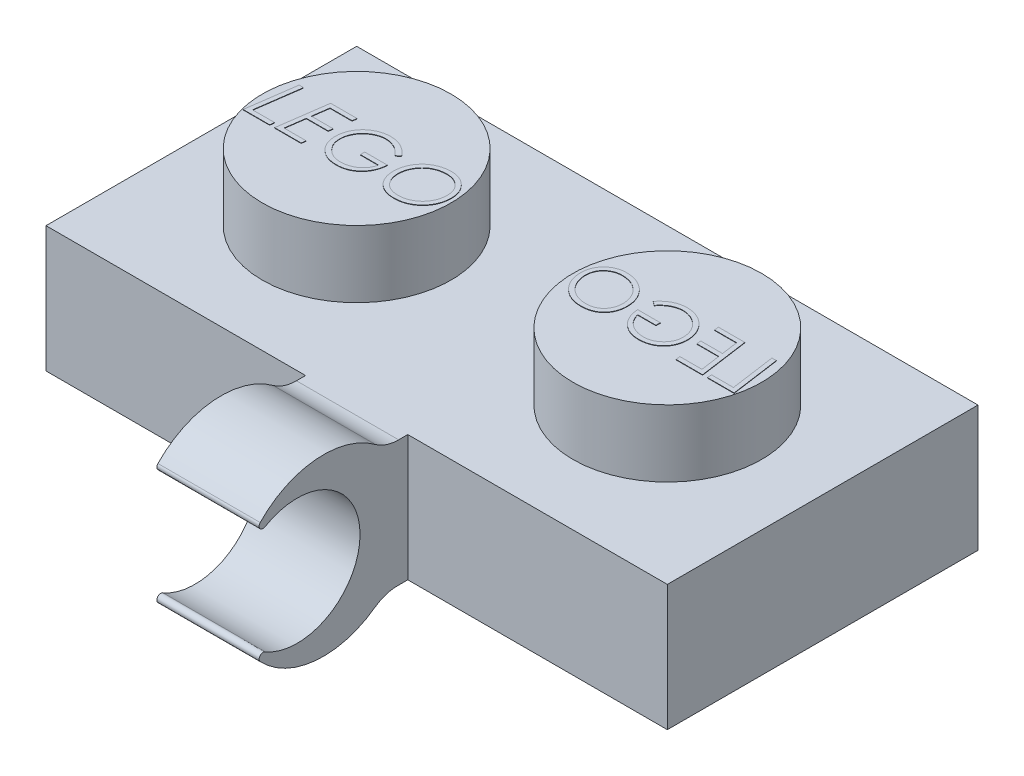
from build123d import *

# Parameters (mm, degrees)
SKETCH1_W                = 7.9
SKETCH1_H                = 7.9
BOSS_EXTRUDE1_DEPTH      = 3.2
SKETCH2_R                = 2.4
BOSS_EXTRUDE2_DEPTH      = 1.7
BOSS_EXTRUDE4_DEPTH      = 0.01
SKETCH4_W                = 6.679581062
SKETCH4_H                = 6.679581062
CUT_EXTRUDE1_DEPTH       = 2.01
BOSS_EXTRUDE5_START      = -2.01
SKETCH5_R                = 1.021947204
SKETCH5_R_2              = 1.041114876
SKETCH5_R_3              = 1.016069602
BOSS_EXTRUDE5_DEPTH      = 2.01
BOSS_EXTRUDE7_DEPTH      = 1.3
BOSS_EXTRUDE7_DEPTH_BACK = 1.3
FILLET2_R                = 0.1
FILLET5_R                = 1


with BuildPart() as part:
    # Sketch1 → Boss-Extrude1 (new body)
    with BuildSketch(Plane(origin=(0, 0, 0), x_dir=(1, 0, 0), z_dir=(0, 1, 0))):
        with Locations((3.95, 3.95)):
            Rectangle(SKETCH1_W, SKETCH1_H)
    extrude(amount=BOSS_EXTRUDE1_DEPTH)

    # Sketch2 → Boss-Extrude2 (add)
    with BuildSketch(Plane(origin=(0, 3.2, 0), x_dir=(1, 0, 0), z_dir=(0, 1, 0))):
        with Locations((3.95, 3.95)):
            Circle(SKETCH2_R)
    extrude(amount=BOSS_EXTRUDE2_DEPTH)

    # Sketch3 → Boss-Extrude4 (add)
    # profile 1 of 4: a face of its own
    with BuildSketch(Plane(origin=(0, 4.9, 0), x_dir=(1, 0, 0), z_dir=(0, 1, 0))):
        Polygon((1.832282536, 4.604898123), (1.945463626, 4.604898123), (1.785708017, 3.46707761), (2.346104652, 3.46707761), (2.331831815, 3.354898123), (1.657002088, 3.354898123), align=None)
    # profile 2 of 4: a face of its own
    with BuildSketch(Plane(origin=(0, 4.9, 0), x_dir=(1, 0, 0), z_dir=(0, 1, 0))):
        Polygon((3.307643113, 4.604898123), (3.289864668, 4.492718636), (2.730720036, 4.492718636), (2.672376687, 4.076051969), (3.227514908, 4.076051969), (3.211489267, 3.963872482), (2.656351046, 3.963872482), (2.586990069, 3.46707761), (3.147386703, 3.46707761), (3.132863466, 3.354898123), (2.458284139, 3.354898123), (2.633564588, 4.604898123), align=None)
    # profile 3 of 4: a face of its own
    with BuildSketch(Plane(origin=(0, 4.9, 0), x_dir=(1, 0, 0), z_dir=(0, 1, 0))):
        with BuildLine():
            Line((4.701873883, 4.341727049), (4.602214428, 4.268359661))
            add(Edge.make_bspline(
                [(4.602214428, 4.268359661), (4.594223081, 4.278463296), (4.578382454, 4.298490949), (4.552974208, 4.326751799), (4.526781942, 4.353389692), (4.49925824, 4.377917229), (4.471083571, 4.40112998), (4.441525281, 4.42204341), (4.410978563, 4.441207159), (4.379659496, 4.458649755), (4.347610579, 4.474125482), (4.315396207, 4.487732834), (4.282869127, 4.498922357), (4.250283005, 4.50864136), (4.217299487, 4.51587276), (4.18414763, 4.520710487), (4.150903008, 4.524293062), (4.128633082, 4.524610402), (4.117438786, 4.524769918)],
                knots=[0, 0, 0, 0, 1.088205139, 2.157064813, 3.209299296, 4.24303109, 5.270682624, 6.292193363, 7.299904734, 8.316436989, 9.319473328, 10.305733085, 11.269264382, 12.22444877, 13.177574148, 14.119122834, 15.054550362, 16, 16, 16, 16], degree=3))
            add(Edge.make_bspline(
                [(4.117438786, 4.524769918), (4.104994375, 4.524521107), (4.080132736, 4.524024028), (4.043033101, 4.520256885), (4.006376299, 4.51354748), (3.969908323, 4.504926578), (3.933893833, 4.493301772), (3.898252767, 4.479273564), (3.86309309, 4.462612711), (3.828430169, 4.443710217), (3.794953431, 4.422557236), (3.762954424, 4.399818018), (3.733183783, 4.375017311), (3.704650221, 4.34913067), (3.678490591, 4.320990985), (3.654040353, 4.291325456), (3.631570613, 4.259970376), (3.610753816, 4.22729124), (3.592321888, 4.193377608), (3.576332398, 4.158696131), (3.562301633, 4.123622124), (3.551463822, 4.087613068), (3.542488613, 4.051135011), (3.536702509, 4.013925289), (3.532682003, 3.976230124), (3.532229884, 3.950862463), (3.532002088, 3.938081216)],
                knots=[0, 0, 0, 0, 0.97704485, 1.95195533, 2.923843304, 3.901415526, 4.89212417, 5.89249681, 6.906854198, 7.94508701, 8.99059592, 10.014519948, 11.024825533, 12.031297736, 13.037428488, 14.038509295, 15.047964276, 16.064309815, 17.079005887, 18.075937854, 19.061713623, 20.042247028, 21.026191147, 22.008802999, 22.996754876, 24, 24, 24, 24], degree=3))
            add(Edge.make_bspline(
                [(3.532002088, 3.938081216), (3.532369323, 3.920940483), (3.533092921, 3.887166428), (3.54080397, 3.83756171), (3.552297071, 3.789703796), (3.569345009, 3.743984102), (3.590663785, 3.700113704), (3.616898701, 3.658340736), (3.647995923, 3.618632516), (3.683169388, 3.581124089), (3.721975609, 3.547190184), (3.762989457, 3.517071082), (3.806208637, 3.491553815), (3.851780792, 3.471217023), (3.899058754, 3.454481236), (3.948703848, 3.443615036), (4.000192874, 3.436168993), (4.035279814, 3.435410998), (4.053085822, 3.435026328)],
                knots=[0, 0, 0, 0, 1.019699772, 2.00921373, 2.981850619, 3.945611549, 4.907936516, 5.881372837, 6.876399243, 7.906447893, 8.938173367, 9.941073143, 10.932270214, 11.919723139, 12.908225854, 13.912405215, 14.940582182, 16, 16, 16, 16], degree=3))
            add(Edge.make_bspline(
                [(4.053085822, 3.435026328), (4.074581254, 3.435599426), (4.11748625, 3.436743331), (4.180872469, 3.447608002), (4.243162184, 3.464003995), (4.303115661, 3.48756372), (4.359892332, 3.516274774), (4.411741714, 3.54979345), (4.457784869, 3.587961635), (4.498384943, 3.630580026), (4.53303885, 3.678554542), (4.563120551, 3.731230233), (4.587740602, 3.789373269), (4.599634966, 3.830601123), (4.605720036, 3.851692995)],
                knots=[0, 0, 0, 0, 1.033792167, 2.063454529, 3.086685911, 4.12966393, 5.157365104, 6.144632769, 7.094686579, 8.02963692, 8.969786061, 9.935985671, 10.944065236, 12, 12, 12, 12], degree=3))
            Line((4.605720036, 3.851692995), (4.140976447, 3.851692995))
            Line((4.140976447, 3.851692995), (4.140976447, 3.963872482))
            Line((4.140976447, 3.963872482), (4.717899524, 3.963872482))
            add(Edge.make_bspline(
                [(4.717899524, 3.963872482), (4.715864452, 3.940537279), (4.711874195, 3.894782885), (4.69942647, 3.828086612), (4.68199329, 3.764774229), (4.659173945, 3.704861641), (4.630919519, 3.648505742), (4.59774963, 3.595348644), (4.559285746, 3.545571633), (4.515814341, 3.499721655), (4.46844757, 3.458302738), (4.417878433, 3.421925394), (4.364351012, 3.391393009), (4.308182236, 3.366007973), (4.248908241, 3.346854494), (4.187007442, 3.33278705), (4.12217798, 3.324364805), (4.078067373, 3.323359246), (4.055589828, 3.322846841)],
                knots=[0, 0, 0, 0, 1.098006248, 2.152910829, 3.176693714, 4.174102283, 5.154427425, 6.128677043, 7.108165613, 8.099464247, 9.087077226, 10.054952015, 11.015803916, 11.972468591, 12.940477937, 13.931877037, 14.946141749, 16, 16, 16, 16], degree=3))
            add(Edge.make_bspline(
                [(4.055589828, 3.322846841), (4.032525547, 3.323342362), (3.987411429, 3.324311611), (3.9214857, 3.332876212), (3.858807865, 3.34620412), (3.799404334, 3.365318809), (3.743277296, 3.389857102), (3.690679177, 3.420179827), (3.641268759, 3.455657405), (3.595689928, 3.496348401), (3.554559756, 3.541197331), (3.518567584, 3.589307242), (3.487743642, 3.639999747), (3.462901044, 3.693721351), (3.443468533, 3.750181555), (3.429856098, 3.809437188), (3.421311108, 3.871476007), (3.420325278, 3.913764014), (3.419822601, 3.935326809)],
                knots=[0, 0, 0, 0, 1.117903688, 2.186638197, 3.21780727, 4.221242465, 5.20706516, 6.182431358, 7.159609539, 8.151436913, 9.139682433, 10.10533578, 11.060397566, 12.011007066, 12.969638005, 13.950363306, 14.954883424, 16, 16, 16, 16], degree=3))
            add(Edge.make_bspline(
                [(3.419822601, 3.935326809), (3.420138952, 3.950859376), (3.420767729, 3.981731803), (3.424963713, 4.027616327), (3.432679126, 4.072646659), (3.442852825, 4.116910735), (3.455965552, 4.160496846), (3.471933961, 4.20328178), (3.491087489, 4.245242481), (3.513047729, 4.286115161), (3.537530339, 4.325600602), (3.564271155, 4.363247138), (3.593498243, 4.398542313), (3.624507556, 4.432098501), (3.658146201, 4.463054417), (3.693847346, 4.491888255), (3.731480716, 4.518905381), (3.77142415, 4.543221398), (3.812846375, 4.565137356), (3.855118915, 4.584605211), (3.898469674, 4.600573637), (3.942428974, 4.613905323), (3.987291028, 4.624144078), (4.032916476, 4.631801844), (4.079465257, 4.63599767), (4.110753822, 4.636631416), (4.12645321, 4.636949405)],
                knots=[0, 0, 0, 0, 1.01034602, 2.008157081, 2.993527994, 3.979930372, 4.960683832, 5.951959865, 6.948100503, 7.958563211, 8.967975239, 9.968308804, 10.959584837, 11.946808627, 12.938010319, 13.930059161, 14.930392727, 15.949048275, 16.969091794, 17.977364349, 18.973726886, 19.971641333, 20.963333569, 21.964771492, 22.978801278, 24, 24, 24, 24], degree=3))
            add(Edge.make_bspline(
                [(4.12645321, 4.636949405), (4.140647989, 4.63666956), (4.168739982, 4.636115737), (4.210476499, 4.63288549), (4.251380819, 4.627152534), (4.29129634, 4.618801418), (4.330484053, 4.608567941), (4.368675988, 4.59577053), (4.406070924, 4.580754735), (4.442474857, 4.563343269), (4.478143584, 4.543914061), (4.512619765, 4.521658579), (4.546625807, 4.497640881), (4.579591338, 4.471153536), (4.611552577, 4.442077414), (4.642675265, 4.410871755), (4.673242279, 4.377555225), (4.692243855, 4.353777591), (4.701873883, 4.341727049)],
                knots=[0, 0, 0, 0, 1.015105213, 2.008930748, 2.991454354, 3.966534974, 4.923490216, 5.886087319, 6.844809209, 7.803252371, 8.770243484, 9.747130909, 10.735853235, 11.746297741, 12.768902994, 13.824016992, 14.897208497, 16, 16, 16, 16], degree=3))
        make_face()
    # profile 4 of 4: a face of its own
    with BuildSketch(Plane(origin=(0, 4.9, 0), x_dir=(1, 0, 0), z_dir=(0, 1, 0))):
        with BuildLine():
            add(Edge.make_bspline(
                [(5.671925966, 4.636949405), (5.692400623, 4.63650345), (5.732667893, 4.635626396), (5.791703582, 4.627669814), (5.84816478, 4.614697282), (5.901922783, 4.596339067), (5.953136821, 4.572927607), (6.001690741, 4.544284414), (6.047399306, 4.510158163), (6.09025375, 4.471611385), (6.129154607, 4.429051867), (6.163160058, 4.383201547), (6.192058383, 4.334734533), (6.215910086, 4.283554512), (6.233823478, 4.229366588), (6.246743033, 4.172603876), (6.255145963, 4.113110877), (6.255950492, 4.072491917), (6.256361062, 4.051763107)],
                knots=[0, 0, 0, 0, 1.061681398, 2.087996504, 3.083659545, 4.062660971, 5.02945529, 5.999994507, 6.981138296, 7.983640916, 8.985844288, 9.966988076, 10.939736476, 11.908342154, 12.890058995, 13.894159216, 14.925339913, 16, 16, 16, 16], degree=3))
            add(Edge.make_bspline(
                [(6.256361062, 4.051763107), (6.25623821, 4.038988627), (6.255995471, 4.01374805), (6.253408976, 3.976225127), (6.249128591, 3.939561124), (6.243455349, 3.903597875), (6.235835613, 3.868539787), (6.226924527, 3.834140064), (6.216051359, 3.800598383), (6.20384118, 3.767696929), (6.189792262, 3.735595516), (6.173946521, 3.704324105), (6.15669213, 3.673663515), (6.137607818, 3.643838863), (6.11686312, 3.614849105), (6.094393683, 3.586665409), (6.070489857, 3.559187301), (6.044887258, 3.532733386), (6.018336956, 3.507212599), (5.990529993, 3.48355884), (5.962091012, 3.461350566), (5.932834084, 3.440746086), (5.90250067, 3.422121085), (5.871581935, 3.404690573), (5.839905885, 3.388861691), (5.807185809, 3.375183309), (5.773789823, 3.362832151), (5.739620564, 3.352089492), (5.704582969, 3.343076229), (5.668762424, 3.335500733), (5.632062087, 3.329787275), (5.594535036, 3.325855801), (5.556279304, 3.323200874), (5.530454147, 3.322965537), (5.51742877, 3.322846841)],
                knots=[0, 0, 0, 0, 1.057694632, 2.089855924, 3.112648636, 4.113725536, 5.103331559, 6.082381806, 7.055068159, 8.021768845, 8.98743121, 9.954922249, 10.923671581, 11.89959402, 12.885451751, 13.874212627, 14.883322035, 15.900071676, 16.921812937, 17.931632203, 18.921551953, 19.909055848, 20.892997665, 21.867769094, 22.84762411, 23.823252803, 24.802912784, 25.795362855, 26.787788858, 27.797679081, 28.826061376, 29.861826465, 30.921574152, 32, 32, 32, 32], degree=3))
            add(Edge.make_bspline(
                [(5.51742877, 3.322846841), (5.495540081, 3.323312388), (5.45279647, 3.324221496), (5.390401025, 3.331753811), (5.331466149, 3.34468508), (5.275615882, 3.361975519), (5.223270197, 3.38492417), (5.174339628, 3.412892082), (5.128783581, 3.445910526), (5.086763869, 3.483632016), (5.049135515, 3.525626819), (5.016044394, 3.570822838), (4.988418107, 3.619388761), (4.96538613, 3.670881503), (4.948106883, 3.725740589), (4.935156589, 3.783416472), (4.927613141, 3.844314319), (4.926699871, 3.88597706), (4.926232857, 3.907281937)],
                knots=[0, 0, 0, 0, 1.121422378, 2.189881799, 3.214223923, 4.209829567, 5.180887389, 6.136870002, 7.092517675, 8.058664933, 9.02481219, 9.976998316, 10.923432162, 11.882748215, 12.86205079, 13.865508147, 14.908495107, 16, 16, 16, 16], degree=3))
            add(Edge.make_bspline(
                [(4.926232857, 3.907281937), (4.92651465, 3.92390256), (4.927073619, 3.956871533), (4.931757127, 4.005792823), (4.939128338, 4.053761359), (4.950024433, 4.100549976), (4.963594459, 4.14639076), (4.979990494, 4.191253803), (5.000003008, 4.234848241), (5.022452359, 4.277389438), (5.047513645, 4.318359564), (5.07559856, 4.356880644), (5.105216605, 4.393691441), (5.137816677, 4.42780852), (5.172496353, 4.459796588), (5.209524734, 4.489546335), (5.248906172, 4.516814917), (5.290422211, 4.541753927), (5.333531205, 4.564369022), (5.378335052, 4.583562961), (5.424193072, 4.600182058), (5.471345954, 4.613795807), (5.519847317, 4.623918047), (5.569406413, 4.631466127), (5.620254649, 4.636113027), (5.6545551, 4.636668231), (5.671925966, 4.636949405)],
                knots=[0, 0, 0, 0, 1.027038055, 2.037251559, 3.03463374, 4.024476576, 5.003805404, 5.987972729, 6.973761106, 7.966047439, 8.95963362, 9.938921687, 10.910571097, 11.877553313, 12.852319973, 13.824735949, 14.81069978, 15.81041387, 16.816403723, 17.816876174, 18.82042938, 19.829469955, 20.847307225, 21.880377804, 22.926554263, 24, 24, 24, 24], degree=3))
        make_face()
        with BuildLine():
            add(Edge.make_bspline(
                [(5.671925966, 4.524769918), (5.65697579, 4.524545747), (5.627444828, 4.524102944), (5.583747158, 4.520086709), (5.541191397, 4.514393729), (5.499970629, 4.505322476), (5.459846772, 4.494612055), (5.421182876, 4.480527241), (5.383524652, 4.464643931), (5.34726264, 4.446055377), (5.312516644, 4.425361321), (5.279529586, 4.402463835), (5.248469657, 4.377453479), (5.219370347, 4.350164922), (5.191739723, 4.321307483), (5.166361885, 4.289965789), (5.142845474, 4.256628787), (5.121196386, 4.221501346), (5.10164712, 4.185107003), (5.08492909, 4.147719282), (5.070612165, 4.109847114), (5.058744989, 4.071497155), (5.049737471, 4.032481304), (5.043287884, 3.99291855), (5.039049877, 3.95269661), (5.03862585, 3.92565532), (5.038412344, 3.912039549)],
                knots=[0, 0, 0, 0, 1.093710758, 2.16039807, 3.20900896, 4.233234191, 5.246749975, 6.245527847, 7.241594159, 8.235879922, 9.224691631, 10.198908654, 11.171861231, 12.139893662, 13.116290872, 14.093089164, 15.087825051, 16.099756899, 17.110766713, 18.108591704, 19.094380672, 20.071961556, 21.043859171, 22.021859724, 23.00397114, 24, 24, 24, 24], degree=3))
            add(Edge.make_bspline(
                [(5.038412344, 3.912039549), (5.038625982, 3.900599914), (5.039049193, 3.877938292), (5.041777549, 3.844392517), (5.046595514, 3.811801965), (5.053065301, 3.780081073), (5.061542906, 3.749273697), (5.072183234, 3.719394567), (5.084405544, 3.690349568), (5.098393626, 3.662290632), (5.114175341, 3.635553687), (5.131389377, 3.61020951), (5.150226394, 3.586682218), (5.170360361, 3.564729612), (5.191972025, 3.544421151), (5.214980987, 3.52555365), (5.239648771, 3.508615875), (5.265465573, 3.492943288), (5.292687864, 3.479247808), (5.321165948, 3.467438697), (5.350786278, 3.457432665), (5.381544214, 3.449135171), (5.413524888, 3.442928532), (5.44663118, 3.438448028), (5.480905707, 3.435639812), (5.504152208, 3.435232585), (5.515926367, 3.435026328)],
                knots=[0, 0, 0, 0, 1.083699529, 2.146780792, 3.185591126, 4.202843058, 5.211856999, 6.209655863, 7.20532214, 8.195415879, 9.177202942, 10.14436246, 11.095191523, 12.029705806, 12.963818608, 13.902338257, 14.845476191, 15.796042213, 16.761390084, 17.729066592, 18.714222808, 19.721158958, 20.74459932, 21.797962164, 22.884686177, 24, 24, 24, 24], degree=3))
            add(Edge.make_bspline(
                [(5.515926367, 3.435026328), (5.530044188, 3.435228857), (5.558004277, 3.435629962), (5.599524853, 3.440000997), (5.64032433, 3.445959686), (5.680325762, 3.455225454), (5.71965402, 3.466535035), (5.757982705, 3.481070895), (5.795756024, 3.497476377), (5.83237428, 3.51683082), (5.867802238, 3.538111172), (5.901266528, 3.561837848), (5.932774032, 3.587459191), (5.962816859, 3.614626895), (5.990234918, 3.644356353), (6.016009711, 3.675809964), (6.039684501, 3.709331455), (6.061465654, 3.744601276), (6.080935982, 3.781209824), (6.097718361, 3.818903041), (6.112024773, 3.857287248), (6.123844079, 3.896320217), (6.132886835, 3.936161865), (6.139301688, 3.976648339), (6.14355343, 4.017951988), (6.143970816, 4.04574289), (6.144181575, 4.059775927)],
                knots=[0, 0, 0, 0, 1.029812959, 2.039525905, 3.043952503, 4.036919093, 5.033391511, 6.027870106, 7.026035071, 8.036794627, 9.047957848, 10.039952554, 11.027355318, 12.010276797, 12.992858524, 13.975534638, 14.976019862, 15.985163142, 16.99876328, 17.999396818, 18.993875413, 19.986244033, 20.973271002, 21.972624612, 22.976275263, 24, 24, 24, 24], degree=3))
            add(Edge.make_bspline(
                [(6.144181575, 4.059775927), (6.143688983, 4.077993105), (6.142724583, 4.113658826), (6.13551886, 4.16576722), (6.122807184, 4.214771606), (6.105892747, 4.261149785), (6.083400704, 4.304354629), (6.056090597, 4.344736825), (6.024020374, 4.382453222), (5.999069145, 4.404451295), (5.986429171, 4.415595238)],
                knots=[0, 0, 0, 0, 1.085318323, 2.124844004, 3.126009127, 4.096923137, 5.060061729, 6.020100862, 6.997008382, 8, 8, 8, 8], degree=3))
            add(Edge.make_bspline(
                [(5.986429171, 4.415595238), (5.97539623, 4.42431843), (5.953439426, 4.44167857), (5.917982347, 4.463870828), (5.881057133, 4.482788681), (5.842389242, 4.498145486), (5.802091847, 4.510165945), (5.760106575, 4.518646998), (5.716539836, 4.523741692), (5.686963766, 4.524423338), (5.671925966, 4.524769918)],
                knots=[0, 0, 0, 0, 0.992364662, 1.974918139, 2.947382948, 3.917989177, 4.907989082, 5.912266894, 6.938502841, 8, 8, 8, 8], degree=3))
        make_face(mode=Mode.SUBTRACT)
    extrude(amount=BOSS_EXTRUDE4_DEPTH)

    # Sketch4 → Cut-Extrude1 (cut)
    with BuildSketch(Plane.XZ):
        with Locations((3.960209469, -3.960209469)):
            Rectangle(SKETCH4_W, SKETCH4_H)
    extrude(amount=-CUT_EXTRUDE1_DEPTH, mode=Mode.SUBTRACT)

    # Sketch5 → Boss-Extrude5 (add)
    with BuildSketch(Plane(origin=(0, 3.2, 0), x_dir=(1, 0, 0), z_dir=(0, 1, 0)).offset(BOSS_EXTRUDE5_START)):
        with Locations((1.458127833, 1.557811677)):
            Circle(SKETCH5_R)
        with Locations((1.458127833, 6.365232327)):
            Circle(SKETCH5_R_2)
        with BuildLine():
            ThreePointArc((5.605437996, 2.21232194), (7.084971092, 0.850452311), (5.706377057, 2.31441459))
            ThreePointArc((5.706377057, 2.31441459), (5.656671092, 2.262613327), (5.605437996, 2.21232194))
        make_face()
        with Locations((6.369527619, 6.365232327)):
            Circle(SKETCH5_R_3)
    extrude(amount=BOSS_EXTRUDE5_DEPTH)

    # Mirror1: part across plane


with BuildPart() as part_1:
    add(part.part)
    add(part.part.mirror(Plane(origin=(7.9, 3.2, 0), x_dir=(0, 0, 1), z_dir=(-1, 0, 0))))

    # Sketch6 → Boss-Extrude7 (add, two sides: drawn at the far end of the back side and taken through both)
    with BuildSketch(Plane.ZY.offset(-7.9).offset(-BOSS_EXTRUDE7_DEPTH_BACK)):
        with BuildLine():
            Line((0.595821366, 3.2), (0, 3.2))
            Line((0, 3.2), (0, 0))
            Line((0, 0), (0.611046421, 0))
            ThreePointArc((0.611046421, 0), (2.679632901, -0.548489397), (4.251274325, 0.904037325))
            ThreePointArc((4.251274325, 0.904037325), (1.214131973, 1.607330906), (4.251274325, 2.310624487))
            ThreePointArc((4.251274325, 2.310624487), (2.669369931, 3.765674075), (0.595821366, 3.2))
        make_face()
    extrude(amount=BOSS_EXTRUDE7_DEPTH + BOSS_EXTRUDE7_DEPTH_BACK)

    # Fillet2
    fillet2_edges = [part_1.edges().sort_by_distance(p)[0] for p in [
        (7.9, 0.904037325, 4.251274325),
        (7.9, 2.310624487, 4.251274325),
    ]]
    fillet(fillet2_edges, radius=FILLET2_R)

    # Fillet5
    fillet5_edges = [part_1.edges().sort_by_distance(p)[0] for p in [
        (7.9, 0, 0.611046421),
        (7.9, 3.2, 0.595821366),
    ]]
    fillet(fillet5_edges, radius=FILLET5_R)


solid = part_1.part
